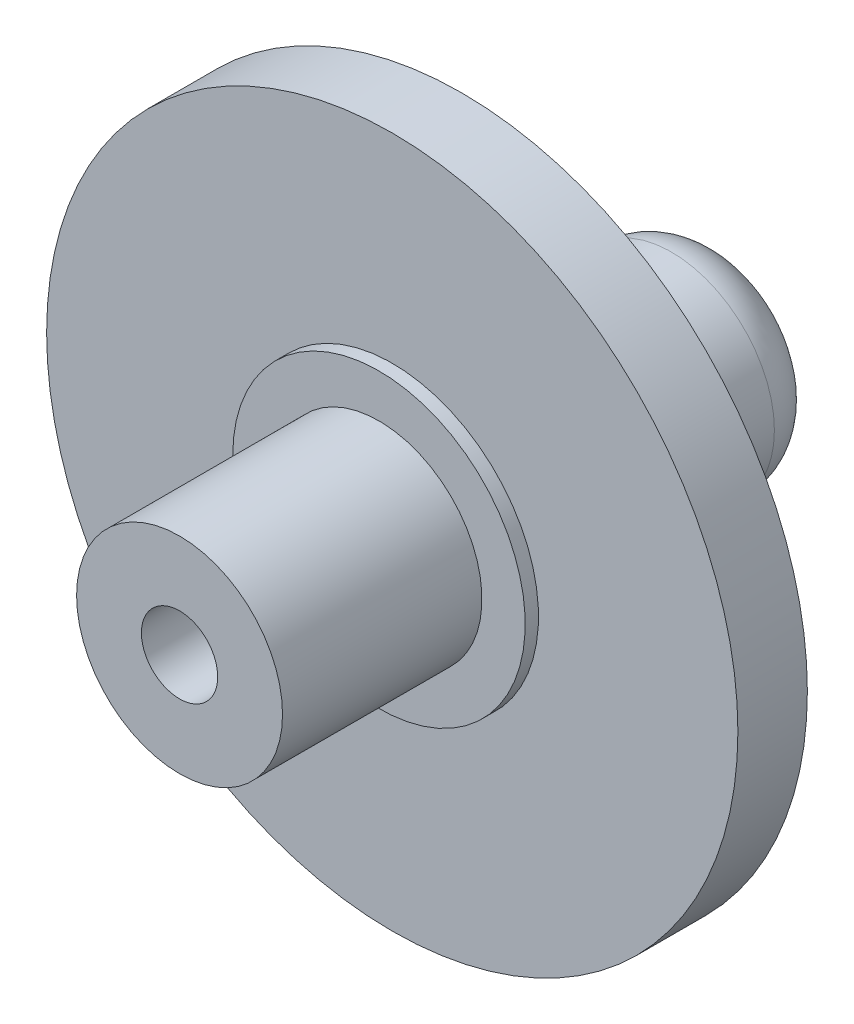
from build123d import *

# Parameters (mm, degrees)
SKETCH1_R               = 3.873
BOSS_EXTRUDE1_DEPTH     = 7
FILLET1_R               = 2.000000064
BOSS_EXTRUDE2_START     = 3
SKETCH2_R               = 8
SKETCH2_R_2             = 3.873
BOSS_EXTRUDE2_DEPTH     = 3
SKETCH3_R               = 13
BOSS_EXTRUDE3_DEPTH     = 2.5
CHAMFER1_SIZE           = 5.196152423
CHAMFER1_SIZE_2         = 3
BOSS_EXTRUDE4_START     = 8
SKETCH4_R               = 3.873
SKETCH4_R_2             = 1.435
BOSS_EXTRUDE4_DEPTH     = 8
BOSS_EXTRUDE5_START     = 0.5
SKETCH4_3_R             = 5.5
SKETCH4_3_R_2           = 3.873
SKETCH4_3_R_3           = 1.435
BOSS_EXTRUDE5_DEPTH     = 0.5
CUT_EXTRUDE1_DEPTH      = 67.017971016
CUT_EXTRUDE1_DEPTH_BACK = 67.017971016
SKETCH6_R               = 1.435


with BuildPart() as part:
    # Sketch1 → Boss-Extrude1 (new body)
    with BuildSketch(Plane.XY):
        with Locations((40.399999972, -23.75)):
            Circle(SKETCH1_R)
    extrude(amount=-BOSS_EXTRUDE1_DEPTH)

    # Fillet1
    fillet1_edges = [part.edges().sort_by_distance(p)[0] for p in [
        (36.526999972, -23.75, -7),
    ]]
    fillet(fillet1_edges, radius=FILLET1_R)

    # Sketch2 → Boss-Extrude2 (add)
    # profile 1 of 2: a face of its own
    with BuildSketch(Plane.XY.offset(BOSS_EXTRUDE2_START)):
        with Locations((40.399999972, -23.75)):
            Circle(SKETCH2_R)
        with Locations((40.399999972, -23.75)):
            Circle(SKETCH2_R_2, mode=Mode.SUBTRACT)
    # profile 2 of 2: a face of its own
    with BuildSketch(Plane.XY.offset(BOSS_EXTRUDE2_START)):
        with Locations((40.399999972, -23.75)):
            Circle(SKETCH2_R_2)
    extrude(amount=-BOSS_EXTRUDE2_DEPTH)

    # Sketch3 → Boss-Extrude3 (add)
    with BuildSketch(Plane.XY.offset(3)):
        with Locations(Location((40.399999972, -23.75, 0), (0, 0, 180))):
            Circle(SKETCH3_R)
    extrude(amount=BOSS_EXTRUDE3_DEPTH)

    # Chamfer1
    # the kernel refuses this chamfer: 5.196152423, 3 mm, written as the material it adds along each edge
    with BuildSketch(Plane(origin=(40.399999972, -23.75, 3), x_dir=(1, 0, 0), z_dir=(0, -1, 0))) as chamfer1_piece_1_section:
        Polygon((8 + CHAMFER1_SIZE, 0), (8, -CHAMFER1_SIZE_2), (8, 0), align=None)
    chamfer1_piece_1 = revolve(axis=Axis((40.399999972, -23.75, 3), (0, 0, 1)), mode=Mode.PRIVATE)
    chamfer1_piece_1 = chamfer1_piece_1 & Plane(origin=(40.399999972, -23.75, 1.510979696), x_dir=(-1, 0, 0), z_dir=(0, 0, -1)) * Cylinder(13, 53, mode=Mode.PRIVATE)
    add(chamfer1_piece_1)

    # Sketch4 → Boss-Extrude4 (add)
    with BuildSketch(Plane.XY.offset(5.5).offset(BOSS_EXTRUDE4_START)):
        with Locations((40.399999972, -23.75)):
            Circle(SKETCH4_R)
        with Locations(Location((40.399999972, -23.75, 0), (0, 0, 180))):
            Circle(SKETCH4_R_2, mode=Mode.SUBTRACT)
    extrude(amount=-BOSS_EXTRUDE4_DEPTH)

    # Sketch4<3> → Boss-Extrude5 (add)
    # profile 1 of 2: a face of its own
    with BuildSketch(Plane.XY.offset(5.5).offset(BOSS_EXTRUDE5_START)):
        with Locations(Location((40.399999972, -23.75, 0), (0, 0, 180))):
            Circle(SKETCH4_3_R)
        with Locations((40.399999972, -23.75)):
            Circle(SKETCH4_3_R_2, mode=Mode.SUBTRACT)
    # profile 2 of 2: a face of its own
    with BuildSketch(Plane.XY.offset(5.5).offset(BOSS_EXTRUDE5_START)):
        with Locations((40.399999972, -23.75)):
            Circle(SKETCH4_3_R_2)
        with Locations(Location((40.399999972, -23.75, 0), (0, 0, 180))):
            Circle(SKETCH4_3_R_3, mode=Mode.SUBTRACT)
    extrude(amount=-BOSS_EXTRUDE5_DEPTH)

    # Sketch6 → Cut-Extrude1 (cut, two sides: drawn at the far end of the back side and taken through both)
    with BuildSketch(Plane.XY.offset(5.5).offset(-CUT_EXTRUDE1_DEPTH_BACK)):
        with Locations(Location((40.399999972, -23.75, 0), (0, 0, 180))):
            Circle(SKETCH6_R)
    extrude(amount=CUT_EXTRUDE1_DEPTH + CUT_EXTRUDE1_DEPTH_BACK, mode=Mode.SUBTRACT)


solid = part.part
